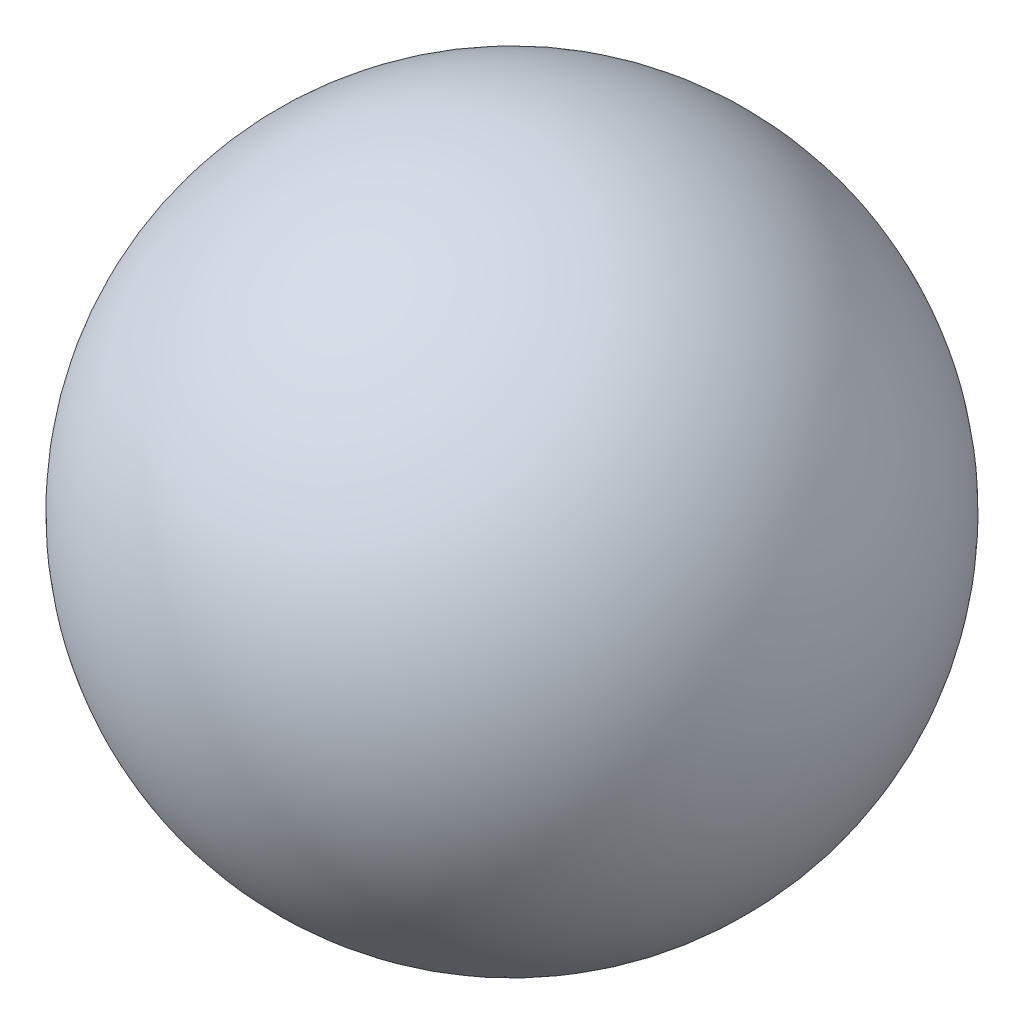
from build123d import *


with BuildPart() as part:
    # Sketch1 → HollowBall (revolve)
    with BuildSketch(Plane(origin=(0, 0, 0), x_dir=(1, 0, 0), z_dir=(0, 1, 0))):
        with BuildLine():
            Line((0, 42.45), (0, 44.45))
            ThreePointArc((0, 44.45), (-44.45, 0), (0, -44.45))
            Line((0, -44.45), (0, -42.45))
            ThreePointArc((0, -42.45), (-42.45, 0), (0, 42.45))
        make_face()
    revolve(axis=Axis((0, 0, -44.45), (0, 0, 1)))


solid = part.part
